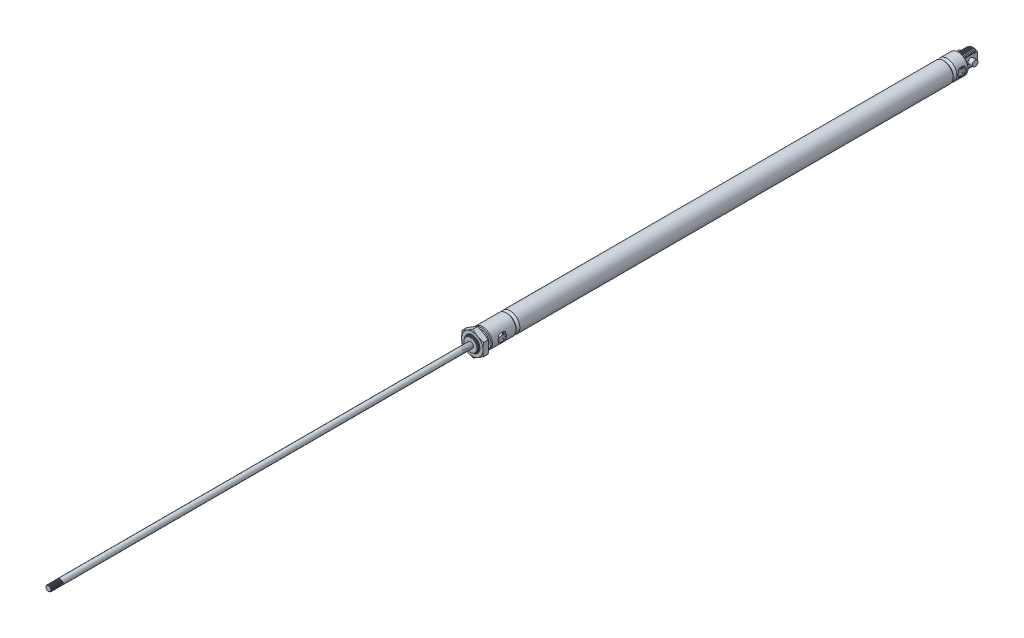
from build123d import *
from build123d.topology import SkipClean

# Parameters (mm, degrees)
SKETCH1_W            = 546.862
SKETCH1_H            = 10.922
SKETCH58_W           = 15.748
SKETCH58_H           = 2.9845
SKETCH59_OUTSIDE_W   = 133.39
SKETCH59_OUTSIDE_H   = 133.39
SKETCH59_OUTSIDE_W_2 = 9.525
SKETCH59_OUTSIDE_H_2 = 15.875
CUT_EXTRUDE3_DEPTH   = 15.748
CHAMFER1_SIZE        = 0.7874
SKETCH4_W            = 12.7
SKETCH4_H            = 7.9375
LPATTERN2_COUNT      = 2
LPATTERN2_PITCH      = 1.411111224
LPATTERN2_COL_COUNT  = 9
LPATTERN2_COL_PITCH  = 1.411111224
SKETCH53_W           = 2.286
SKETCH53_H           = 7.9375
LPATTERN5_COUNT      = 11
LPATTERN5_PITCH      = 1.411111224
SKETCH60_R           = 3.175
EXTRUDE2_DEPTH       = 9.525
LPATTERN3_COUNT      = 2
LPATTERN3_PITCH      = 0.907142966
LPATTERN3_COL_COUNT  = 14
LPATTERN3_COL_PITCH  = 0.907142966
LPATTERN4_COUNT      = 2
LPATTERN4_PITCH      = 457.2
SKETCH54_R           = 7.9375
EXTRUDE1_DEPTH       = 3.175


with BuildPart() as part:
    # Sketch1 → Revolve1 (revolve)
    with BuildSketch(Plane(origin=(0, 0, 0), x_dir=(0, 0, -1), z_dir=(1, 0, 0)), mode=Mode.PRIVATE) as revolve1_sk:
        with Locations((12.7, 5.461)):
            Rectangle(SKETCH1_W, SKETCH1_H)
    revolve(revolve1_sk.sketch.rotate(Axis((0, 0, -286.131), (0, 0, -1)), 270), axis=Axis((0, 0, -286.131), (0, 0, -1)))

    # Sketch58 → Cut-Revolve25 (revolve, cut)
    with BuildSketch(Plane(origin=(0, 0, 0), x_dir=(0, 0, -1), z_dir=(1, 0, 0)), mode=Mode.PRIVATE) as cut_revolve25_sk:
        with Locations((278.257, 9.42975)):
            Rectangle(SKETCH58_W, SKETCH58_H)
    revolve(cut_revolve25_sk.sketch.rotate(Axis((0, 0, -286.131), (0, 0, -1)), 270), axis=Axis((0, 0, -286.131), (0, 0, -1)), mode=Mode.SUBTRACT)

    # Sketch59 outside → Cut-Extrude3 (cut)
    with BuildSketch(Plane(origin=(0, 0, -286.131), x_dir=(-1, 0, 0), z_dir=(0, 0, -1))):
        Rectangle(SKETCH59_OUTSIDE_W, SKETCH59_OUTSIDE_H)
        Rectangle(SKETCH59_OUTSIDE_W_2, SKETCH59_OUTSIDE_H_2, mode=Mode.SUBTRACT)
    extrude(amount=-CUT_EXTRUDE3_DEPTH, mode=Mode.SUBTRACT)

    # Chamfer1
    chamfer1_edges = [part.edges().sort_by_distance(p)[0] for p in [
        (0, -7.9375, -286.131),
        (10.922, 0, 260.731),
        (10.922, 0, -270.383),
        (0, 7.9375, -286.131),
    ]]
    chamfer(chamfer1_edges, length=CHAMFER1_SIZE)



with BuildPart() as body_2:
    # Sketch4 → Revolve2 (revolve)
    with BuildSketch(Plane(origin=(0, 0, 0), x_dir=(0, 0, -1), z_dir=(1, 0, 0)), mode=Mode.PRIVATE) as revolve2_sk:
        with Locations((-267.081, 3.96875)):
            Rectangle(SKETCH4_W, SKETCH4_H)
    revolve(revolve2_sk.sketch.rotate(Axis((0, 0, 273.431), (0, 0, -1)), 90), axis=Axis((0, 0, 273.431), (0, 0, -1)))

    # Sketch5 → Cut-Revolve2 (revolve, cut)
    with BuildSketch(Plane(origin=(0, 0, 0), x_dir=(0, 0, -1), z_dir=(1, 0, 0)), mode=Mode.PRIVATE) as cut_revolve2_sk:
        Polygon((-273.25530384, 7.953117438), (-272.025430718, 8.062439502), (-272.397045629, 7.262609217), (-272.74843795, 7.231374341), align=None)
    cut_revolve2 = revolve(cut_revolve2_sk.sketch.rotate(Axis((0, -0.133549816, 273.431), (0, 0.08853979731145027, -0.996072640068006)), 180), axis=Axis((0, -0.133549816, 273.431), (0, 0.08853979731145027, -0.996072640068006)), mode=Mode.SUBTRACT)

    # Sketch6 → Cut-Revolve3 (revolve, cut)
    with BuildSketch(Plane(origin=(0, 0, 0), x_dir=(0, 0, -1), z_dir=(1, 0, 0)), mode=Mode.PRIVATE) as cut_revolve3_sk:
        Polygon((-273.431, 7.231374341), (-272.207954482, 7.9375), (-273.431, 7.9375), align=None)
    revolve(cut_revolve3_sk.sketch.rotate(Axis((0, 0, 0), (0, 0, 1)), 270), axis=Axis((0, 0, 0), (0, 0, 1)), mode=Mode.SUBTRACT)

    # LPattern2: Cut-Revolve2 ×2
    with Locations(*[(0, 0, i * LPATTERN2_PITCH) for i in range(1, LPATTERN2_COUNT)]):
        add(cut_revolve2, mode=Mode.SUBTRACT)

    # LPattern2 col: Cut-Revolve2 ×9
    with Locations(*[(0, 0, -i * LPATTERN2_COL_PITCH) for i in range(1, LPATTERN2_COL_COUNT)]):
        add(cut_revolve2, mode=Mode.SUBTRACT)


with BuildPart() as part_1:
    with SkipClean():  # the faces are left unmerged after this step: merging them gives an invalid solid
        add(part.part)

        add(body_2.part)  # Revolve4 merges body 2
        # Sketch53 → Revolve4 (revolve)
        with BuildSketch(Plane(origin=(0, 0, 0), x_dir=(0, 0, -1), z_dir=(1, 0, 0)), mode=Mode.PRIVATE) as revolve4_sk:
            with Locations((-261.874, 3.96875)):
                Rectangle(SKETCH53_W, SKETCH53_H)
        revolve(revolve4_sk.sketch.rotate(Axis((0, 0, 260.731), (0, 0, 1)), 125.383849969), axis=Axis((0, 0, 260.731), (0, 0, 1)))

    # Sketch62 → Cut-Revolve26 (revolve, cut)
    with SkipClean():  # the faces are left unmerged after this step: merging them gives an invalid solid
        with BuildSketch(Plane(origin=(0, 0, 0), x_dir=(0, 0, -1), z_dir=(1, 0, 0))):
            Polygon((270.55869616, 7.953117438), (271.788569282, 8.062439502), (271.416954371, 7.262609217), (271.06556205, 7.231374341), align=None)
        cut_revolve26 = revolve(axis=Axis((0, -0.133549816, -270.383), (0, 0.08853979731145126, -0.9960726400680059)), mode=Mode.SUBTRACT)

    # LPattern5: Cut-Revolve26 ×11
    with SkipClean():  # the faces are left unmerged after this step: merging them gives an invalid solid
        with Locations(*[(0, 0, -i * LPATTERN5_PITCH) for i in range(1, LPATTERN5_COUNT)]):
            add(cut_revolve26, mode=Mode.SUBTRACT)

    # Sketch60 → Extrude2 (add, symmetric)
    with SkipClean():  # the faces are left unmerged after this step: merging them gives an invalid solid
        with BuildSketch(Plane(origin=(0, 0, 0), x_dir=(0, 0, -1), z_dir=(1, 0, 0))):
            with Locations(Location((279.019, 0, 0), (0, 0, 180))):
                Circle(SKETCH60_R)
        extrude(amount=EXTRUDE2_DEPTH, both=True)

    # Sketch7 → Cut-Revolve5 (revolve, cut)
    with SkipClean():  # the faces are left unmerged after this step: merging them gives an invalid solid
        with BuildSketch(Plane(origin=(0, 0, 0), x_dir=(0, 0, -1), z_dir=(1, 0, 0)), mode=Mode.PRIVATE) as cut_revolve5_sk:
            Polygon((-273.431, 3.2004), (-257.556, 3.2004), (-257.556, 6.3627), (-215.392, 6.3627), (-215.392, 9.525), (-209.042, 9.525), (248.158, 9.525), (248.158, 0), (-273.431, 0), align=None)
            Polygon((253.111, 10.922), (254.508, 9.525), (254.508, 8.128), (257.302, 10.922), align=None)
            Polygon((-233.553, 10.922), (-232.156, 9.525), (-232.156, 8.128), (-229.362, 10.922), align=None)
        revolve(cut_revolve5_sk.sketch.rotate(Axis((0, 0, -248.158), (0, 0, -1)), 180), axis=Axis((0, 0, -248.158), (0, 0, -1)), mode=Mode.SUBTRACT)

    # Sketch13 → Cut-Revolve22 (revolve, cut)
    with SkipClean():  # the faces are left unmerged after this step: merging them gives an invalid solid
        with BuildSketch(Plane(origin=(-356.431898312, -1.751719437, -263.271), x_dir=(1, 0, 0), z_dir=(0, 0, 1))):
            Polygon((355.923898312, 1.751719437), (355.923898312, 5.954267841), (355.940851644, 5.985872426), (356.351637466, 6.751663784), (356.387484506, 6.75278406), (356.845286365, 6.014137423), (356.881133404, 6.015257699), (357.291919226, 6.781049057), (357.327766266, 6.782169333), (357.785568125, 6.043522697), (357.821415164, 6.044642973), (358.232200986, 6.810434331), (358.268048026, 6.811554607), (358.725849885, 6.07290797), (358.761696925, 6.074028246), (359.172482747, 6.839819604), (359.208329786, 6.84093988), (359.666131645, 6.102293244), (359.701978685, 6.10341352), (360.112764507, 6.869204878), (360.148611546, 6.870325154), (360.606413405, 6.131678517), (360.642260445, 6.132798793), (361.053046267, 6.898590151), (361.088893307, 6.899710427), (361.546695166, 6.161063791), (361.582542205, 6.162184066), (361.993328027, 6.927975424), (362.029175067, 6.9290957), (362.486976926, 6.190449064), (362.522823965, 6.19156934), (362.933609788, 6.957360698), (362.969456827, 6.958480974), (363.427258686, 6.219834337), (363.463105726, 6.220954613), (363.873891548, 6.986745971), (363.909738587, 6.987866247), (364.367540446, 6.249219611), (364.403387486, 6.250339887), (364.814173308, 7.016131245), (364.850020348, 7.017251521), (365.307822206, 6.278604884), (365.343669246, 6.27972516), (365.754455068, 7.045516518), (365.790302108, 7.046636794), (366.248103967, 6.307990158), (366.283951006, 6.309110434), (366.694736828, 7.074901792), (366.730583868, 7.076022068), (367.188385727, 6.337375431), (367.224232766, 6.338495707), (367.635018589, 7.104287065), (367.670865628, 7.105407341), (368.128667487, 6.366760705), (368.164514527, 6.367880981), (368.575300349, 7.133672339), (368.611147388, 7.134792615), (369.068949247, 6.396145978), (369.104796287, 6.397266254), (369.515582109, 7.163057612), (369.551429149, 7.164177888), (370.009231008, 6.425531252), (370.045078047, 6.426651528), (370.045078047, 1.751719437), align=None)
        revolve(axis=Axis((-0.508, 0, -263.271), (-1, 0, 0)), mode=Mode.SUBTRACT)

    # Sketch64 → Cut-Revolve27 (revolve, cut)
    with SkipClean():  # the faces are left unmerged after this step: merging them gives an invalid solid
        with BuildSketch(Plane(origin=(-356.431898312, -1.751719437, 248.793), x_dir=(1, 0, 0), z_dir=(0, 0, 1)), mode=Mode.PRIVATE) as cut_revolve27_sk:
            Polygon((355.923898312, 1.751719437), (355.923898312, 5.954267873), (355.949328308, 6.001674747), (356.343160766, 6.735861461), (356.396931321, 6.737541875), (356.835839438, 6.029379604), (356.889609993, 6.031060018), (357.283442451, 6.765246732), (357.337213006, 6.766927146), (357.776121123, 6.058764875), (357.829891678, 6.060445289), (358.223724136, 6.794632004), (358.277494691, 6.796312417), (358.716402808, 6.088150147), (358.770173363, 6.08983056), (359.164005821, 6.824017275), (359.217776376, 6.825697688), (359.656684493, 6.117535418), (359.710455048, 6.119215831), (360.104287506, 6.853402546), (360.158058061, 6.85508296), (360.596966178, 6.146920689), (360.650736733, 6.148601103), (361.044569191, 6.882787817), (361.098339746, 6.884468231), (361.537247863, 6.17630596), (361.591018418, 6.177986374), (361.984850876, 6.912173088), (362.038621431, 6.913853502), (362.477529548, 6.205691231), (362.531300103, 6.207371645), (362.925132561, 6.941558359), (362.978903116, 6.943238773), (363.417811233, 6.235076502), (363.471581788, 6.236756916), (363.865414246, 6.97094363), (363.919184801, 6.972624044), (364.358092918, 6.264461773), (364.411863473, 6.266142187), (364.805695931, 7.000328901), (364.859466486, 7.002009315), (365.298374603, 6.293847044), (365.352145158, 6.295527458), (365.745977616, 7.029714172), (365.799748171, 7.031394586), (366.238656288, 6.323232315), (366.292426843, 6.324912729), (366.686259301, 7.059099443), (366.740029856, 7.060779857), (367.178937973, 6.352617586), (367.232708528, 6.354298), (367.626540986, 7.088484715), (367.680311541, 7.090165128), (368.119219658, 6.382002857), (368.172990213, 6.383683271), (368.566822671, 7.117869986), (368.620593226, 7.119550399), (369.059501343, 6.411388129), (369.113271898, 6.413068542), (369.507104356, 7.147255257), (369.560874911, 7.148935671), (369.999783028, 6.4407734), (370.053553583, 6.442453814), (370.053553583, 1.751719437), align=None)
        revolve(cut_revolve27_sk.sketch.rotate(Axis((-0.508, 0, 248.793), (1, 0, 0)), 90), axis=Axis((-0.508, 0, 248.793), (1, 0, 0)), mode=Mode.SUBTRACT)


with BuildPart() as body_2_2:
    # Sketch8 → Revolve3 (revolve)
    with BuildSketch(Plane(origin=(0, 0, 0), x_dir=(0, 0, -1), z_dir=(1, 0, 0)), mode=Mode.PRIVATE) as revolve3_sk:
        Polygon((241.808, 9.4742), (248.158, 9.4742), (248.158, 0), (-286.131, 0), (-286.131, 3.175), (241.808, 3.175), align=None)
    revolve(revolve3_sk.sketch.rotate(Axis((0, 0, -248.158), (0, 0, 1)), 125.383849969), axis=Axis((0, 0, -248.158), (0, 0, 1)))

    # Sketch10 → Cut-Revolve6 (revolve, cut)
    with BuildSketch(Plane(origin=(0, 0, 0), x_dir=(0, 0, -1), z_dir=(1, 0, 0)), mode=Mode.PRIVATE) as cut_revolve6_sk:
        Polygon((-286.018746785, 3.191036175), (-285.232974282, 3.303289404), (-285.444168642, 2.777128287), (-285.668675072, 2.745055936), align=None)
    cut_revolve6 = revolve(cut_revolve6_sk.sketch.rotate(Axis((0, -0.138431434, 286.131), (0, 0.14142137286845907, -0.9899494912852879)), 180), axis=Axis((0, -0.138431434, 286.131), (0, 0.14142137286845907, -0.9899494912852879)), mode=Mode.SUBTRACT)

    # Sketch11 → Cut-Revolve7 (revolve, cut)
    with BuildSketch(Plane(origin=(0, 0, 0), x_dir=(0, 0, -1), z_dir=(1, 0, 0)), mode=Mode.PRIVATE) as cut_revolve7_sk:
        Polygon((-286.131, 3.175), (-285.386315037, 3.175), (-286.131, 2.745055936), align=None)
    revolve(cut_revolve7_sk.sketch.rotate(Axis((0, 0, 0), (0, 0, 1)), 125.383849969), axis=Axis((0, 0, 0), (0, 0, 1)), mode=Mode.SUBTRACT)

    # LPattern3: Cut-Revolve6 ×2
    with Locations(*[(0, 0, i * LPATTERN3_PITCH) for i in range(1, LPATTERN3_COUNT)]):
        add(cut_revolve6, mode=Mode.SUBTRACT)

    # LPattern3 col: Cut-Revolve6 ×14
    with Locations(*[(0, 0, -i * LPATTERN3_COL_PITCH) for i in range(1, LPATTERN3_COL_COUNT)]):
        add(cut_revolve6, mode=Mode.SUBTRACT)


with BuildPart() as lpattern4_1:
    # LPattern4: pattern copy
    add(body_2_2.part.moved(Location(Vector(0, 0, 1) * (1 * LPATTERN4_PITCH))))


with BuildPart() as body_4:
    # Sketch54 → Extrude1 (new, symmetric)
    with BuildSketch(Plane.XY.offset(268.224)):
        Polygon((0, 13.748153285), (-11.90625, 6.874076643), (-11.90625, -6.874076643), (0, -13.748153285), (11.90625, -6.874076643), (11.90625, 6.874076643), align=None)
        Circle(SKETCH54_R, mode=Mode.SUBTRACT)
    extrude(amount=EXTRUDE1_DEPTH, both=True)

    # Sketch55 → Cut-Revolve24 (revolve, cut)
    with BuildSketch(Plane(origin=(0, 0, 0), x_dir=(0, 0, -1), z_dir=(1, 0, 0)), mode=Mode.PRIVATE) as cut_revolve24_sk:
        Polygon((-270.72860203, 13.748153285), (-271.399, 13.748153285), (-271.399, 11.90625), align=None)
        Polygon((-265.71939797, 13.748153285), (-265.049, 13.748153285), (-265.049, 11.90625), align=None)
        Polygon((-271.399, 8.60789797), (-271.399, 7.9375), (-270.72860203, 7.9375), align=None)
        Polygon((-265.049, 8.60789797), (-265.049, 7.9375), (-265.71939797, 7.9375), align=None)
    revolve(cut_revolve24_sk.sketch.rotate(Axis((0, 0, 0), (0, 0, 1)), 124.802032131), axis=Axis((0, 0, 0), (0, 0, 1)), mode=Mode.SUBTRACT)


solid = Compound([part_1.part, body_2_2.part, lpattern4_1.part, body_4.part])
